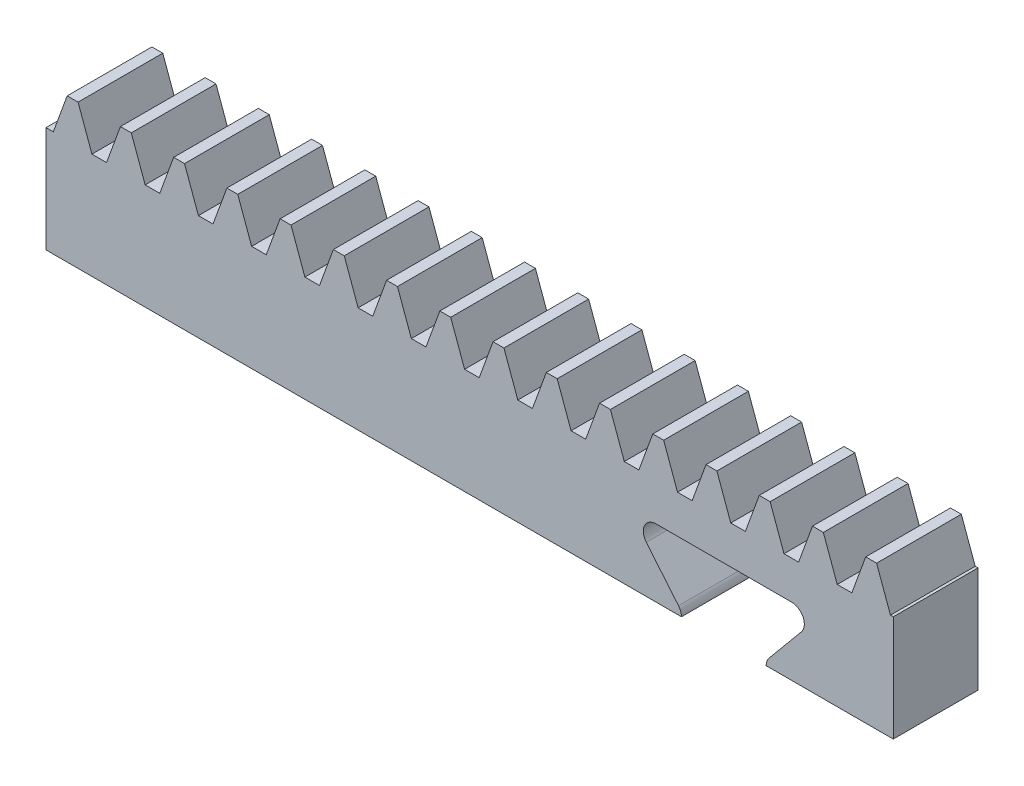
from build123d import *

# Parameters (mm, degrees)
BLANKSKE_W         = 100
BLANKSKE_H         = 17
BLANK_DEPTH        = 10
TOOTHCUTSIM_DEPTH  = 102.926444066
TEETHCUTS_COUNT    = 17
TEETHCUTS_PITCH    = 6.2831853
CUT_EXTRUDE1_DEPTH = 102.926444066


with BuildPart() as part:
    # BlankSke → Blank (new body)
    with BuildSketch(Plane.XY):
        with Locations((50, 8.5)):
            Rectangle(BLANKSKE_W, BLANKSKE_H)
    extrude(amount=-BLANK_DEPTH)

    # TooCutSkeSim → ToothCutSim (cut, through all)
    with BuildSketch(Plane.XY):
        Polygon((0.861870739, 12.5), (-0.861870739, 12.5), (-2.508981637, 17.0254), (2.508981637, 17.0254), align=None)
    toothcutsim = extrude(amount=-TOOTHCUTSIM_DEPTH, mode=Mode.SUBTRACT)

    # TeethCuts: ToothCutSim ×17
    with Locations(*[(i * TEETHCUTS_PITCH, 0, 0) for i in range(1, TEETHCUTS_COUNT)]):
        add(toothcutsim, mode=Mode.SUBTRACT)

    # Sketch1 → Cut-Extrude1 (cut, through all)
    with BuildSketch(Plane.XY):
        with BuildLine():
            Line((88, 8), (72, 8))
            ThreePointArc((72, 8), (70.642089827, 7.137244037), (70.846239786, 5.541439951))
            Line((70.846239786, 5.541439951), (74.653760214, 0.958560049))
            ThreePointArc((74.653760214, 0.958560049), (74.910787071, 0.509587911), (75, 0))
            Line((75, 0), (85, 0))
            ThreePointArc((85, 0), (85.089212929, 0.509587911), (85.346239786, 0.958560049))
            Line((85.346239786, 0.958560049), (89.153760214, 5.541439951))
            ThreePointArc((89.153760214, 5.541439951), (89.357910173, 7.137244037), (88, 8))
        make_face()
    extrude(amount=-CUT_EXTRUDE1_DEPTH, mode=Mode.SUBTRACT)


solid = part.part
